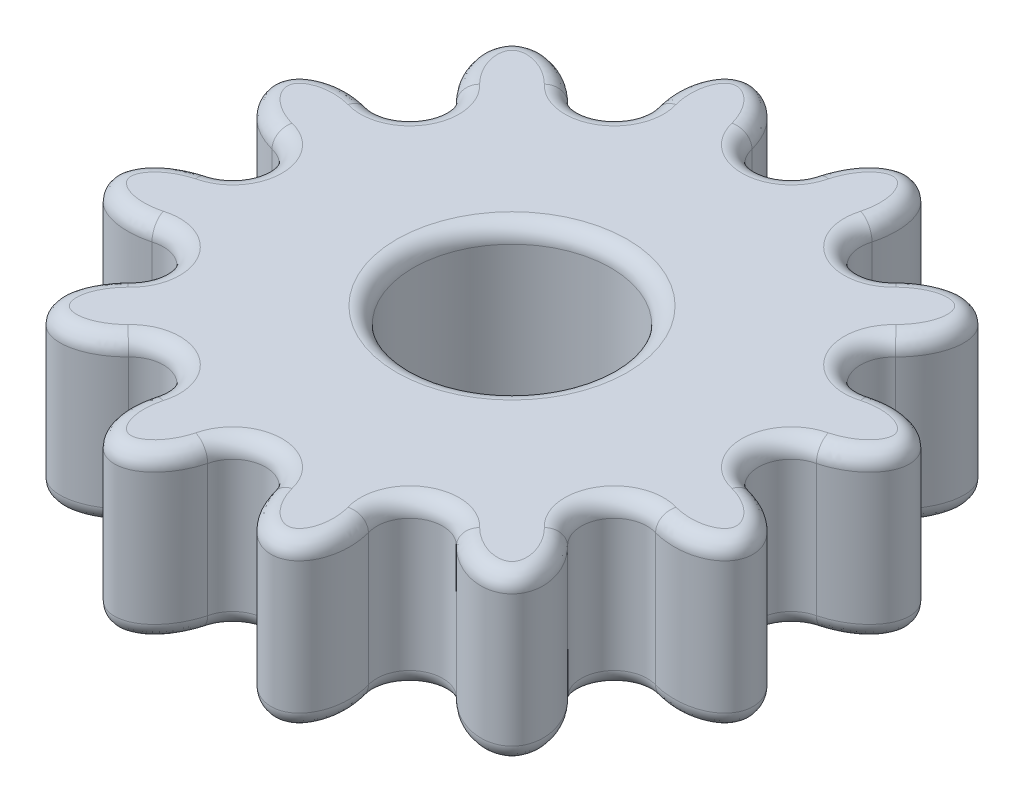
from build123d import *

# Parameters (mm, degrees)
BOSS_EXTRUDE2_DEPTH = 5
SKETCH4_R           = 6
CUT_EXTRUDE3_DEPTH  = 10
FILLET1_R           = 1


with BuildPart() as part:
    # Sketch2 → Boss-Extrude2 (new, symmetric)
    with BuildSketch(Plane(origin=(0, 0, 0), x_dir=(1, 0, 0), z_dir=(0, 1, 0))):
        with BuildLine():
            ThreePointArc((-1.952478224, 16.518952851), (-3.58e-07, 14.952345036), (1.952478069, 16.518952153))
            add(Edge.make_bspline(
                [(6.568580683, 15.282071925), (7.484431713, 18.700076545), (5.176380406, 19.318516659), (2.868329099, 19.936956773), (1.952478069, 16.518952153)],
                knots=[4.71238898, 4.71238898, 4.71238898, 6.283185307, 6.283185307, 7.853981634, 7.853981634, 7.853981634], degree=2, weights=[1, 0.707106781, 1, 0.707106781, 1]))
            ThreePointArc((6.568580683, 15.282071925), (7.476172208, 12.949110826), (9.950371684, 13.329593174))
            add(Edge.make_bspline(
                [(13.329593701, 9.950372167), (15.831746269, 12.452525484), (14.142135261, 14.142135987), (12.452524252, 15.83174649), (9.950371684, 13.329593174)],
                knots=[4.71238898, 4.71238898, 4.71238898, 6.283185307, 6.283185307, 7.853981634, 7.853981634, 7.853981634], degree=2, weights=[1, 0.707106781, 1, 0.707106781, 1]))
            ThreePointArc((13.329593701, 9.950372167), (12.949110469, 7.476172828), (15.282071242, 6.568580469))
            add(Edge.make_bspline(
                [(16.518952851, 1.952478224), (19.936957197, 2.868330276), (19.318516393, 5.176381398), (18.700075589, 7.484432521), (15.282071242, 6.568580469)],
                knots=[4.71238898, 4.71238898, 4.71238898, 6.283185307, 6.283185307, 7.853981634, 7.853981634, 7.853981634], degree=2, weights=[1, 0.707106781, 1, 0.707106781, 1]))
            ThreePointArc((16.518952851, 1.952478224), (14.952345036, 3.58e-07), (16.518952153, -1.952478069))
            add(Edge.make_bspline(
                [(15.282071925, -6.568580683), (18.700076545, -7.484431713), (19.318516659, -5.176380406), (19.936956773, -2.868329099), (16.518952153, -1.952478069)],
                knots=[4.71238898, 4.71238898, 4.71238898, 6.283185307, 6.283185307, 7.853981634, 7.853981634, 7.853981634], degree=2, weights=[1, 0.707106781, 1, 0.707106781, 1]))
            ThreePointArc((15.282071925, -6.568580683), (12.949110826, -7.476172208), (13.329593174, -9.950371684))
            add(Edge.make_bspline(
                [(9.950372167, -13.329593701), (12.452525484, -15.831746269), (14.142135987, -14.142135261), (15.83174649, -12.452524252), (13.329593174, -9.950371684)],
                knots=[1.570796327, 1.570796327, 1.570796327, 3.141592654, 3.141592654, 4.71238898, 4.71238898, 4.71238898], degree=2, weights=[1, 0.707106781, 1, 0.707106781, 1]))
            ThreePointArc((9.950372167, -13.329593701), (7.476172828, -12.949110469), (6.568580469, -15.282071242))
            add(Edge.make_bspline(
                [(1.952478224, -16.518952851), (2.868330276, -19.936957197), (5.176381398, -19.318516393), (7.484432521, -18.700075589), (6.568580469, -15.282071242)],
                knots=[4.71238898, 4.71238898, 4.71238898, 6.283185307, 6.283185307, 7.853981634, 7.853981634, 7.853981634], degree=2, weights=[1, 0.707106781, 1, 0.707106781, 1]))
            ThreePointArc((1.952478224, -16.518952851), (3.58e-07, -14.952345036), (-1.952478069, -16.518952153))
            add(Edge.make_bspline(
                [(-6.568580683, -15.282071925), (-7.484431713, -18.700076545), (-5.176380406, -19.318516659), (-2.868329099, -19.936956773), (-1.952478069, -16.518952153)],
                knots=[4.71238898, 4.71238898, 4.71238898, 6.283185307, 6.283185307, 7.853981634, 7.853981634, 7.853981634], degree=2, weights=[1, 0.707106781, 1, 0.707106781, 1]))
            ThreePointArc((-6.568580683, -15.282071925), (-7.476172208, -12.949110826), (-9.950371684, -13.329593174))
            add(Edge.make_bspline(
                [(-13.329593701, -9.950372167), (-15.831746269, -12.452525484), (-14.142135261, -14.142135987), (-12.452524252, -15.83174649), (-9.950371684, -13.329593174)],
                knots=[1.570796327, 1.570796327, 1.570796327, 3.141592654, 3.141592654, 4.71238898, 4.71238898, 4.71238898], degree=2, weights=[1, 0.707106781, 1, 0.707106781, 1]))
            ThreePointArc((-13.329593701, -9.950372167), (-12.949110469, -7.476172828), (-15.282071242, -6.568580469))
            add(Edge.make_bspline(
                [(-16.518952851, -1.952478224), (-19.936957197, -2.868330276), (-19.318516393, -5.176381398), (-18.700075589, -7.484432521), (-15.282071242, -6.568580469)],
                knots=[1.570796327, 1.570796327, 1.570796327, 3.141592654, 3.141592654, 4.71238898, 4.71238898, 4.71238898], degree=2, weights=[1, 0.707106781, 1, 0.707106781, 1]))
            ThreePointArc((-16.518952851, -1.952478224), (-14.952345036, -3.58e-07), (-16.518952153, 1.952478069))
            add(Edge.make_bspline(
                [(-15.282071925, 6.568580683), (-18.700076545, 7.484431713), (-19.318516659, 5.176380406), (-19.936956773, 2.868329099), (-16.518952153, 1.952478069)],
                knots=[4.71238898, 4.71238898, 4.71238898, 6.283185307, 6.283185307, 7.853981634, 7.853981634, 7.853981634], degree=2, weights=[1, 0.707106781, 1, 0.707106781, 1]))
            ThreePointArc((-15.282071925, 6.568580683), (-12.949110826, 7.476172208), (-13.329593174, 9.950371684))
            add(Edge.make_bspline(
                [(-9.950372167, 13.329593701), (-12.452525484, 15.831746269), (-14.142135987, 14.142135261), (-15.83174649, 12.452524252), (-13.329593174, 9.950371684)],
                knots=[1.570796327, 1.570796327, 1.570796327, 3.141592654, 3.141592654, 4.71238898, 4.71238898, 4.71238898], degree=2, weights=[1, 0.707106781, 1, 0.707106781, 1]))
            ThreePointArc((-9.950372167, 13.329593701), (-7.476172828, 12.949110469), (-6.568580469, 15.282071242))
            add(Edge.make_bspline(
                [(-1.952478224, 16.518952851), (-2.868330276, 19.936957197), (-5.176381398, 19.318516393), (-7.484432521, 18.700075589), (-6.568580469, 15.282071242)],
                knots=[4.71238898, 4.71238898, 4.71238898, 6.283185307, 6.283185307, 7.853981634, 7.853981634, 7.853981634], degree=2, weights=[1, 0.707106781, 1, 0.707106781, 1]))
        make_face()
    extrude(amount=BOSS_EXTRUDE2_DEPTH, both=True)

    # Sketch4 → Cut-Extrude3 (cut)
    with BuildSketch(Plane(origin=(0, 5, 0), x_dir=(1, 0, 0), z_dir=(0, 1, 0))):
        Circle(SKETCH4_R)
    extrude(amount=-CUT_EXTRUDE3_DEPTH, mode=Mode.SUBTRACT)

    # Fillet1
    fillet1_edges = [part.edges().sort_by_distance(p)[0] for p in [
        (-6, -5, 0),
        (-6, 5, 0),
        (-3.58e-07, -5, -14.952345036),
        (-5.176381398, -5, -19.318516393),
        (-7.476172828, -5, -12.949110469),
        (-14.142135987, -5, -14.142135261),
        (-12.949110826, -5, -7.476172208),
        (-19.318516659, -5, -5.176380406),
        (-14.952345036, -5, 3.58e-07),
        (-19.318516393, -5, 5.176381398),
        (-12.949110469, -5, 7.476172828),
        (-14.142135261, -5, 14.142135987),
        (-7.476172208, -5, 12.949110826),
        (-5.176380406, -5, 19.318516659),
        (3.58e-07, -5, 14.952345036),
        (5.176381398, -5, 19.318516393),
        (7.476172828, -5, 12.949110469),
        (14.142135987, -5, 14.142135261),
        (12.949110826, -5, 7.476172208),
        (19.318516659, -5, 5.176380406),
        (14.952345036, -5, -3.58e-07),
        (19.318516393, -5, -5.176381398),
        (12.949110469, -5, -7.476172828),
        (14.142135261, -5, -14.142135987),
        (7.476172208, -5, -12.949110826),
        (5.176380406, -5, -19.318516659),
        (7.476172208, 5, -12.949110826),
        (14.142135261, 5, -14.142135987),
        (12.949110469, 5, -7.476172828),
        (19.318516393, 5, -5.176381398),
        (14.952345036, 5, -3.58e-07),
        (19.318516659, 5, 5.176380406),
        (12.949110826, 5, 7.476172208),
        (14.142135987, 5, 14.142135261),
        (7.476172828, 5, 12.949110469),
        (5.176381398, 5, 19.318516393),
        (3.58e-07, 5, 14.952345036),
        (-5.176380406, 5, 19.318516659),
        (-7.476172208, 5, 12.949110826),
        (-14.142135261, 5, 14.142135987),
        (-12.949110469, 5, 7.476172828),
        (-19.318516393, 5, 5.176381398),
        (-14.952345036, 5, 3.58e-07),
        (-19.318516659, 5, -5.176380406),
        (-12.949110826, 5, -7.476172208),
        (-14.142135987, 5, -14.142135261),
        (-7.476172828, 5, -12.949110469),
        (-5.176381398, 5, -19.318516393),
        (-3.58e-07, 5, -14.952345036),
        (5.176380406, 5, -19.318516659),
    ]]
    fillet(fillet1_edges, radius=FILLET1_R)


solid = part.part
